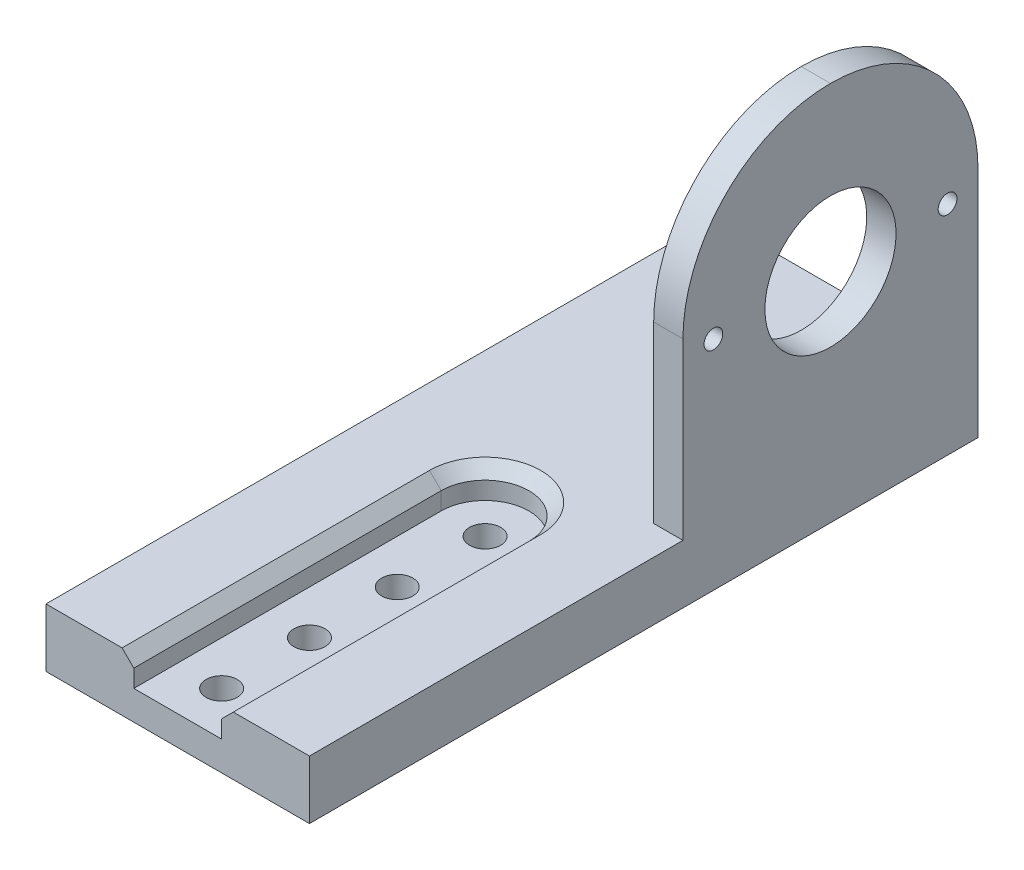
from build123d import *

# Parameters (mm, degrees)
SKETCH1_W           = 57.15
SKETCH1_H           = 145.034
BOSS_EXTRUDE1_DEPTH = 12.7
SKETCH4_R           = 3.3782
CUT_EXTRUDE3_DEPTH  = 157.404199611
CUT_EXTRUDE4_DEPTH  = 6.35
CHAMFER1_SIZE       = 2.54
SKETCH7_W           = 6.35
SKETCH7_H           = 64.008
BOSS_EXTRUDE2_DEPTH = 82.55
SKETCH9_R           = 14.224
SKETCH9_R_2         = 2.032
CUT_EXTRUDE5_DEPTH  = 82.55
FILLET1_R           = 32.004


with BuildPart() as part:
    # Sketch1 → Boss-Extrude1 (new body)
    with BuildSketch(Plane(origin=(0, 0, 0), x_dir=(1, 0, 0), z_dir=(0, 1, 0))):
        with Locations((28.575, 72.517)):
            Rectangle(SKETCH1_W, SKETCH1_H)
    extrude(amount=BOSS_EXTRUDE1_DEPTH)

    # Sketch4 → Cut-Extrude3 (cut, through all)
    with BuildSketch(Plane(origin=(0, 0, 0), x_dir=(-1, 0, 0), z_dir=(0, -1, 0))):
        with Locations(Location((-28.575, 9.525, 0), (0, 0, 90))):
            Circle(SKETCH4_R)
        with Locations(Location((-28.575, 28.575, 0), (0, 0, 90))):
            Circle(SKETCH4_R)
        with Locations(Location((-28.575, 47.625, 0), (0, 0, 90))):
            Circle(SKETCH4_R)
        with Locations(Location((-28.575, 66.675, 0), (0, 0, 90))):
            Circle(SKETCH4_R)
    extrude(amount=-CUT_EXTRUDE3_DEPTH, mode=Mode.SUBTRACT)

    # Sketch8 → Cut-Extrude4 (cut)
    with BuildSketch(Plane(origin=(0, 12.7, 0), x_dir=(1, 0, 0), z_dir=(0, 1, 0))):
        with BuildLine():
            Line((19.05, 66.675), (19.05, 0))
            Line((19.05, 0), (38.1, 0))
            Line((38.1, 0), (38.1, 66.675))
            ThreePointArc((38.1, 66.675), (28.575, 76.2), (19.05, 66.675))
        make_face()
    extrude(amount=-CUT_EXTRUDE4_DEPTH, mode=Mode.SUBTRACT)

    # Chamfer1
    chamfer1_edges = [part.edges().sort_by_distance(p)[0] for p in [
        (28.575, 12.7, -76.2),
        (19.05, 12.7, -33.3375),
        (38.1, 12.7, -33.3375),
    ]]
    chamfer(chamfer1_edges, length=CHAMFER1_SIZE)

    # Sketch7 → Boss-Extrude2 (add)
    with BuildSketch(Plane.XZ):
        with Locations((53.975, -113.03)):
            Rectangle(SKETCH7_W, SKETCH7_H)
    extrude(amount=-BOSS_EXTRUDE2_DEPTH)

    # Sketch9 → Cut-Extrude5 (cut)
    with BuildSketch(Plane.ZY.offset(-50.8)):
        with Locations((-113.03, 47.217289291)):
            Circle(SKETCH9_R)
        with Locations((-87.63, 47.217289291)):
            Circle(SKETCH9_R_2)
        with Locations((-138.43, 47.217289291)):
            Circle(SKETCH9_R_2)
    extrude(amount=-CUT_EXTRUDE5_DEPTH, mode=Mode.SUBTRACT)

    # Fillet1
    fillet1_edges = [part.edges().sort_by_distance(p)[0] for p in [
        (53.975, 82.55, -81.026),
        (53.975, 82.55, -145.034),
    ]]
    fillet(fillet1_edges, radius=FILLET1_R - 0.0001)  # a hair under: the kernel refuses the full size


solid = part.part
